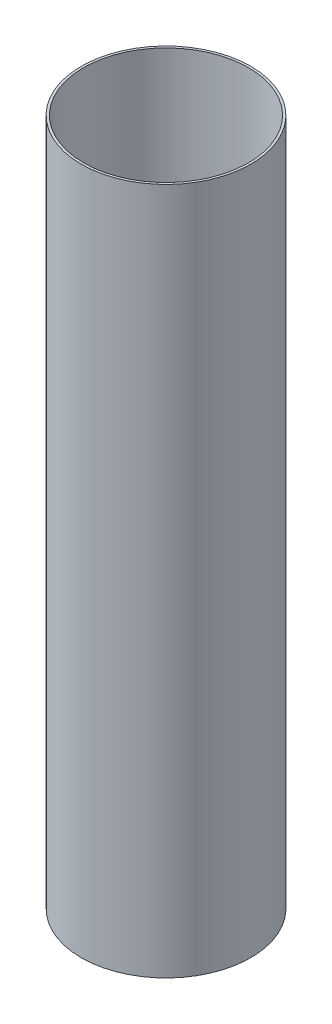
from build123d import *

# Parameters (mm, degrees)
SKETCH1_R           = 7.8359
SKETCH1_R_2         = 7.62
BOSS_EXTRUDE1_DEPTH = 63.5


with BuildPart() as part:
    # Sketch1 → Boss-Extrude1 (new body)
    with BuildSketch(Plane(origin=(0, 0, 0), x_dir=(1, 0, 0), z_dir=(0, 1, 0))):
        Circle(SKETCH1_R)
        Circle(SKETCH1_R_2, mode=Mode.SUBTRACT)
    extrude(amount=BOSS_EXTRUDE1_DEPTH)


solid = part.part
